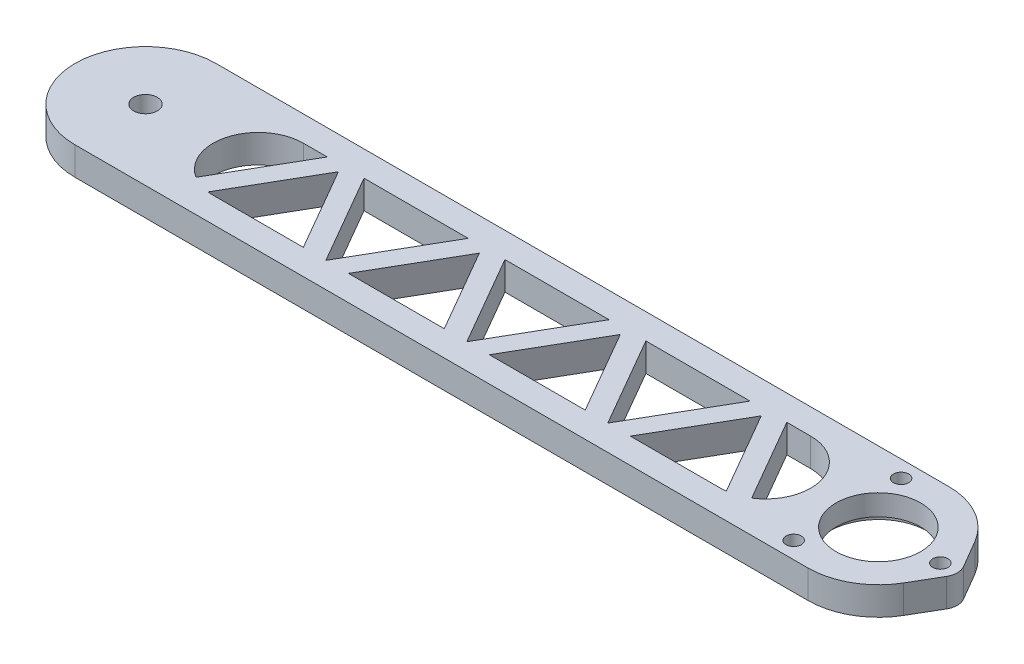
from build123d import *

# Parameters (mm, degrees)
EXTRUDE_1_DEPTH        = 5
EXTRUDE_5_DEPTH        = 5
CUT_EXTRUDE_2_REACH    = 82.139
SKETCH_7_R             = 7.5
SKETCH_8_R             = 8.75
CUT_EXTRUDE_3_DEPTH    = 1.3
CUT_EXTRUDE_4_REACH    = 82.139
SKETCH_9_R             = 1.35
CUT_EXTRUDE_5_REACH    = 82.139
SKETCH_12_R            = 2.1
CUT_EXTRUDE_6_REACH    = 82.139
EXTRUDE_6_DEPTH        = 5
PATTERN_LINEAR_1_DEPTH = 5


# Read off the part's stored shape, not the designer's step: 阵列(线性)1
with BuildPart() as part:
    # 草图1 → 凸台-拉伸1 (new body)
    with BuildSketch(Plane(origin=(0, 0, 0), x_dir=(1, 0, 0), z_dir=(0, 1, 0))):
        with BuildLine():
            Line((-65, 12.5), (65, 12.5))
            ThreePointArc((65, 12.5), (77.5, 0), (65, -12.5))
            Line((65, -12.5), (-65, -12.5))
            ThreePointArc((-65, -12.5), (-77.5, 0), (-65, 12.5))
        make_face()
    extrude(amount=EXTRUDE_1_DEPTH)

    # 草图10 → 凸台-拉伸5 (add)
    with BuildSketch(Plane.XZ):
        with BuildLine():
            Line((75.795454545, -6.301441197), (78.590909091, -1.512345887))
            ThreePointArc((78.590909091, -1.512345887), (79, 0), (78.590909091, 1.512345887))
            Line((78.590909091, 1.512345887), (75.795454545, 6.301441197))
            Line((75.795454545, 6.301441197), (75.795454545, -6.301441197))
        make_face()
    extrude(amount=-EXTRUDE_5_DEPTH)

    # 草图7 → 切除-拉伸2 (cut, up to next)
    with BuildSketch(Plane(origin=(0, 5, 0), x_dir=(1, 0, 0), z_dir=(0, 1, 0)), mode=Mode.PRIVATE) as cut_extrude_2_sk1:
        with Locations(Location((65, 0, 0), (0, 0, 270))):
            Circle(SKETCH_7_R)
    cut_extrude_2_tool1 = extrude(cut_extrude_2_sk1.sketch, amount=-CUT_EXTRUDE_2_REACH, mode=Mode.PRIVATE) & part.part
    add(cut_extrude_2_tool1.solids().sort_by_distance((65, 5, 0))[0], mode=Mode.SUBTRACT)

    # 草图8 → 切除-拉伸3 (cut)
    with BuildSketch(Plane(origin=(0, 0, 0), x_dir=(1, 0, 0), z_dir=(0, 1, 0))):
        with Locations(Location((65, 0, 0), (0, 0, 270))):
            Circle(SKETCH_8_R)
    extrude(amount=CUT_EXTRUDE_3_DEPTH, mode=Mode.SUBTRACT)

    # 草图9 → 切除-拉伸4 (cut, up to next)
    with BuildSketch(Plane.XZ, mode=Mode.PRIVATE) as cut_extrude_4_sk1:
        with Locations(Location((59.5, 9.526279442, 0), (0, 0, 270))):
            Circle(SKETCH_9_R)
    cut_extrude_4_tool1 = extrude(cut_extrude_4_sk1.sketch, amount=-CUT_EXTRUDE_4_REACH, mode=Mode.PRIVATE) & part.part
    # 草图9 → 切除-拉伸4 (cut, up to next)
    with BuildSketch(Plane.XZ, mode=Mode.PRIVATE) as cut_extrude_4_sk2:
        with Locations(Location((76, 0, 0), (0, 0, 270))):
            Circle(SKETCH_9_R)
    cut_extrude_4_tool2 = extrude(cut_extrude_4_sk2.sketch, amount=-CUT_EXTRUDE_4_REACH, mode=Mode.PRIVATE) & part.part
    # 草图9 → 切除-拉伸4 (cut, up to next)
    with BuildSketch(Plane.XZ, mode=Mode.PRIVATE) as cut_extrude_4_sk3:
        with Locations(Location((59.5, -9.526279442, 0), (0, 0, 270))):
            Circle(SKETCH_9_R)
    cut_extrude_4_tool3 = extrude(cut_extrude_4_sk3.sketch, amount=-CUT_EXTRUDE_4_REACH, mode=Mode.PRIVATE) & part.part
    add(cut_extrude_4_tool1.solids().sort_by_distance((59.5, 0, 9.526279))[0], mode=Mode.SUBTRACT)
    add(cut_extrude_4_tool2.solids().sort_by_distance((76, 0, 0))[0], mode=Mode.SUBTRACT)
    add(cut_extrude_4_tool3.solids().sort_by_distance((59.5, 0, -9.526279))[0], mode=Mode.SUBTRACT)

    # 草图12 → 切除-拉伸5 (cut, up to next)
    with BuildSketch(Plane(origin=(0, 5, 0), x_dir=(1, 0, 0), z_dir=(0, 1, 0)), mode=Mode.PRIVATE) as cut_extrude_5_sk1:
        with Locations(Location((-65, 0, 0), (0, 0, 270))):
            Circle(SKETCH_12_R)
    cut_extrude_5_tool1 = extrude(cut_extrude_5_sk1.sketch, amount=-CUT_EXTRUDE_5_REACH, mode=Mode.PRIVATE) & part.part
    add(cut_extrude_5_tool1.solids().sort_by_distance((-65, 5, 0))[0], mode=Mode.SUBTRACT)

    # 草图13 → 切除-拉伸6 (cut, up to next)
    with BuildSketch(Plane(origin=(0, 5, 0), x_dir=(1, 0, 0), z_dir=(0, 1, 0)), mode=Mode.PRIVATE) as cut_extrude_6_sk1:
        with BuildLine():
            Line((-45, 8), (45, 8))
            ThreePointArc((45, 8), (53, 0), (45, -8))
            Line((45, -8), (-45, -8))
            ThreePointArc((-45, -8), (-53, 0), (-45, 8))
        make_face()
    cut_extrude_6_tool1 = extrude(cut_extrude_6_sk1.sketch, amount=-CUT_EXTRUDE_6_REACH, mode=Mode.PRIVATE) & part.part
    add(cut_extrude_6_tool1.solids().sort_by_distance((0, 5, 0))[0], mode=Mode.SUBTRACT)

    # 草图14 → 凸台-拉伸6 (add)
    with BuildSketch(Plane(origin=(0, 5, 0), x_dir=(1, 0, 0), z_dir=(0, 1, 0))):
        Polygon((0, -8), (9.237604307, 8), (13.237604307, 8), (4, -8), align=None)
    extrude_6 = extrude(amount=-EXTRUDE_6_DEPTH)

    # 阵列(线性)1 outline → 阵列(线性)1 (add)
    with BuildSketch(Plane(origin=(0, 0, 0), x_dir=(1, 0, 0), z_dir=(0, 1, 0))):
        Polygon((38.237604307, 8), (34.237604307, 8), (25, -8), (29, -8), align=None)
        Polygon((-11.762395693, 8), (-15.762395693, 8), (-25, -8), (-21, -8), align=None)
        with BuildLine():
            Line((-45.966190603, -7.941440406), (-36.762395693, 8))
            Line((-36.762395693, 8), (-40.762395693, 8))
            Line((-40.762395693, 8), (-49.282491188, -6.757238284))
            ThreePointArc((-49.282491188, -6.757238284), (-47.690306451, -7.534072683), (-45.966190603, -7.941440406))
        make_face()
    pattern_linear_1 = extrude(amount=PATTERN_LINEAR_1_DEPTH)

    # 镜向1: 凸台-拉伸6, 阵列(线性)1 across plane
    add(extrude_6.mirror(Plane(origin=(0, 0, 0), x_dir=(0, 0, 1), z_dir=(1, 0, 0))))
    add(pattern_linear_1.mirror(Plane(origin=(0, 0, 0), x_dir=(0, 0, 1), z_dir=(1, 0, 0))))


solid = part.part
